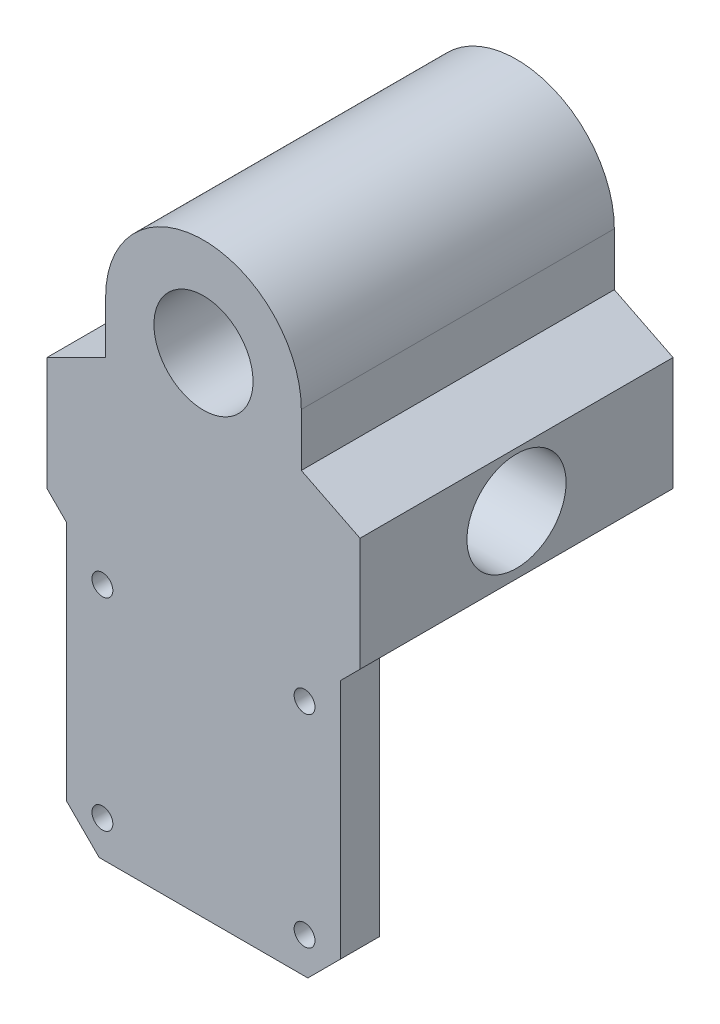
from build123d import *

# Parameters (mm, degrees)
BOSS_EXTRUDE1_DEPTH      = 55
BOSS_EXTRUDE1_DEPTH_BACK = 5
SKETCH1_W                = 48
SKETCH1_H                = 48
SKETCH2_R                = 7.6
CUT_EXTRUDE1_DEPTH       = 77.843997814
SKETCH3_R                = 7.6
CUT_EXTRUDE2_DEPTH       = 77.843997814
SKETCH6_W                = 42
SKETCH6_H                = 42
BOSS_EXTRUDE2_DEPTH      = 6
SKETCH7_R                = 1.6
CUT_EXTRUDE4_DEPTH       = 74.246160309
CUT_EXTRUDE5_DEPTH       = 77.843997814
CHAMFER12_SIZE           = 5
CHAMFER12_SIZE_2         = 10
CHAMFER13_SIZE           = 10
CHAMFER13_SIZE_2         = 5
CHAMFER14_SIZE           = 3
CHAMFER15_SIZE           = 5


with BuildPart() as part:
    # Sketch1 → Boss-Extrude1 (new, two sides: drawn at the far end of the back side and taken through both)
    with BuildSketch(Plane(origin=(0, 0, 0), x_dir=(1, 0, 0), z_dir=(0, 1, 0)).offset(-BOSS_EXTRUDE1_DEPTH_BACK)):
        Rectangle(SKETCH1_W, SKETCH1_H)
    extrude(amount=BOSS_EXTRUDE1_DEPTH + BOSS_EXTRUDE1_DEPTH_BACK)

    # Sketch2 → Cut-Extrude1 (cut, through all)
    with BuildSketch(Plane.XY.offset(24)):
        with Locations((0, 28)):
            Circle(SKETCH2_R)
    extrude(amount=-CUT_EXTRUDE1_DEPTH, mode=Mode.SUBTRACT)

    # Sketch3 → Cut-Extrude2 (cut, through all)
    with BuildSketch(Plane(origin=(24, 0, 0), x_dir=(0, 0, -1), z_dir=(1, 0, 0))):
        with Locations((0, 7)):
            Circle(SKETCH3_R)
    extrude(amount=-CUT_EXTRUDE2_DEPTH, mode=Mode.SUBTRACT)

    # Sketch6 → Boss-Extrude2 (add)
    with BuildSketch(Plane.XY.offset(24)):
        with Locations((0, -26)):
            Rectangle(SKETCH6_W, SKETCH6_H)
    extrude(amount=-BOSS_EXTRUDE2_DEPTH)

    # Sketch7 → Cut-Extrude4 (cut, through all)
    with BuildSketch(Plane(origin=(0, 0, 18), x_dir=(-1, 0, 0), z_dir=(0, 0, -1))):
        with Locations((-15.5, -10.5)):
            Circle(SKETCH7_R)
        with Locations((-15.5, -41.5)):
            Circle(SKETCH7_R)
        with Locations((15.5, -41.5)):
            Circle(SKETCH7_R)
        with Locations((15.5, -10.5)):
            Circle(SKETCH7_R)
    extrude(amount=-CUT_EXTRUDE4_DEPTH, mode=Mode.SUBTRACT)

    # Sketch9 → Cut-Extrude5 (cut, through all)
    with BuildSketch(Plane(origin=(0, 0, -24), x_dir=(-1, 0, 0), z_dir=(0, 0, -1))):
        with BuildLine():
            Line((-15, 28), (-15, 20.4))
            Line((-15, 20.4), (-24, 20.4))
            Line((-24, 20.4), (-24, 55))
            Line((-24, 55), (24, 55))
            Line((24, 55), (24, 20.4))
            Line((24, 20.4), (15, 20.4))
            Line((15, 20.4), (15, 28))
            ThreePointArc((15, 28), (0, 43), (-15, 28))
        make_face()
    extrude(amount=-CUT_EXTRUDE5_DEPTH, mode=Mode.SUBTRACT)

    # Chamfer12
    # the kernel refuses this chamfer: 10, 5 mm, written as the material it takes off along each edge
    with BuildSketch(Plane(origin=(24, 20.4, -49.898288738), x_dir=(0.06891834360170909, -0.9976223042390326, 0), z_dir=(0, 0, 1))) as chamfer12_piece_1_section:
        Polygon((CHAMFER12_SIZE * 0.997622304239, -CHAMFER12_SIZE * 0.0689183436017), (-CHAMFER12_SIZE_2 * 0.0689183436017, -CHAMFER12_SIZE_2 * 0.997622304239), (0, 0), align=None)
    chamfer12_piece_1 = extrude(amount=99.796577476, mode=Mode.PRIVATE)
    chamfer12_piece_1 = split(chamfer12_piece_1, bisect_by=Plane(origin=(15, 18.773620907, 0), z_dir=(1, 0, 0)), keep=Keep.TOP, mode=Mode.PRIVATE)
    add(chamfer12_piece_1, mode=Mode.SUBTRACT)

    # Chamfer13
    # the kernel refuses this chamfer: 10, 5 mm, written as the material it takes off along each edge
    with BuildSketch(Plane(origin=(-24, 20.4, -49.898288738), x_dir=(0.9998508956747119, 0.017268075123668212, 0), z_dir=(0, 0, 1))) as chamfer13_piece_1_section:
        Polygon((CHAMFER13_SIZE * 0.999850895675, -CHAMFER13_SIZE * 0.0172680751237), (-CHAMFER13_SIZE_2 * 0.0172680751237, -CHAMFER13_SIZE_2 * 0.999850895675), (0, 0), align=None)
    chamfer13_piece_1 = extrude(amount=99.796577476, mode=Mode.PRIVATE)
    chamfer13_piece_1 = split(chamfer13_piece_1, bisect_by=Plane(origin=(-15, 18.773620907, 0), z_dir=(-1, 0, 0)), keep=Keep.TOP, mode=Mode.PRIVATE)
    add(chamfer13_piece_1, mode=Mode.SUBTRACT)

    # Chamfer14
    chamfer14_edges = [part.edges().sort_by_distance(p)[0] for p in [
        (-24, -5, 0),
        (24, -5, 0),
    ]]
    chamfer(chamfer14_edges, length=CHAMFER14_SIZE)

    # Chamfer15
    chamfer15_edges = [part.edges().sort_by_distance(p)[0] for p in [
        (-21, -47, 21),
        (21, -47, 21),
    ]]
    chamfer(chamfer15_edges, length=CHAMFER15_SIZE)


solid = part.part
